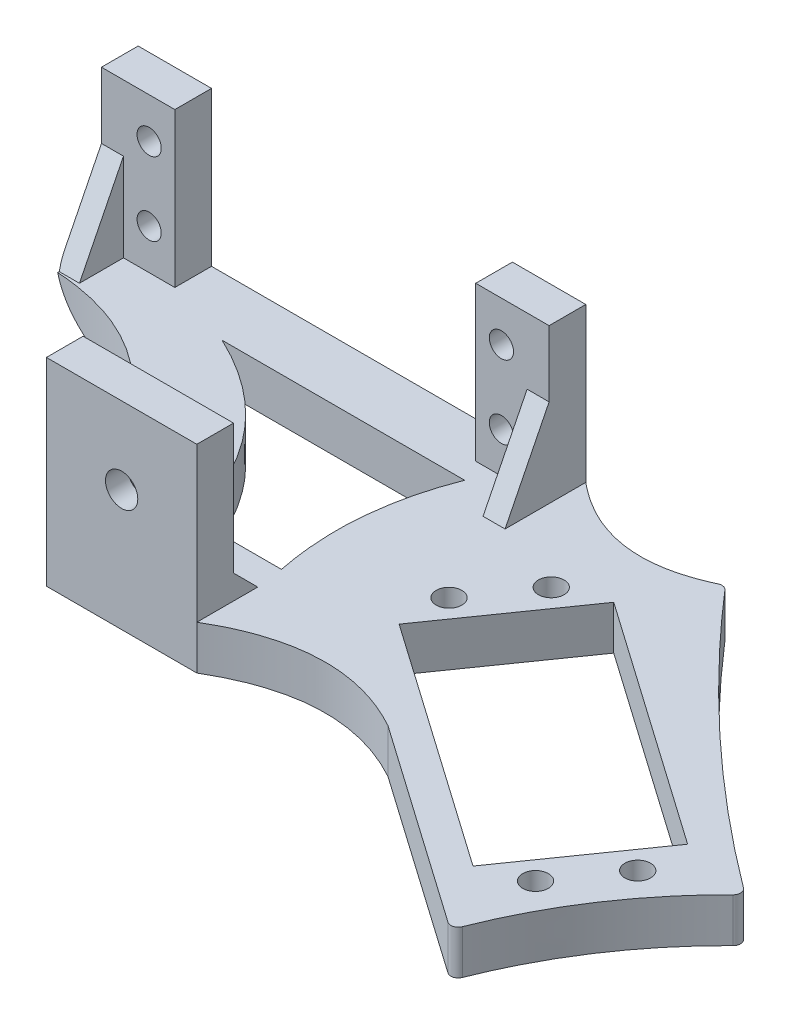
from build123d import *

# Parameters (mm, degrees)
SKETCH1_W               = 130
SKETCH1_H               = 70
BOSS_EXTRUDE1_DEPTH     = 27
SKETCH2_R               = 1.75
CUT_EXTRUDE1_DEPTH      = 27
CUT_EXTRUDE2_START      = -21
CUT_EXTRUDE2_OUTLINE_R  = 1.75
CUT_EXTRUDE2_DEPTH      = 21
CUT_EXTRUDE3_DEPTH      = 100.823879977
CUT_EXTRUDE3_DEPTH_BACK = 100.823879977
CUT_EXTRUDE4_DEPTH      = 80.987499152
CUT_EXTRUDE4_DEPTH_BACK = 80.987499152
SKETCH5_R               = 1.65
SKETCH5_R_2             = 2.2
CUT_EXTRUDE5_DEPTH      = 2
FILLET2_R               = 8


# Read off the part's stored shape, not the designer's step: Cut-Extrude2
with BuildPart() as part:
    # Sketch1 → Boss-Extrude1 (new body)
    with BuildSketch(Plane(origin=(0, 0, 0), x_dir=(1, 0, 0), z_dir=(0, 1, 0))):
        Rectangle(SKETCH1_W, SKETCH1_H)
    extrude(amount=BOSS_EXTRUDE1_DEPTH)

    # Sketch2 → Cut-Extrude1 (cut)
    with BuildSketch(Plane(origin=(0, 27, 0), x_dir=(1, 0, 0), z_dir=(0, 1, 0))):
        with BuildLine():
            Line((65, 35), (-4, 35))
            add(Edge.make_bspline(
                [(16.985276193, 32.037400285), (16.344384253, 31.734586923), (15.139997676, 31.224413868), (13.363177927, 30.647367552), (11.717672063, 30.264833972), (10.188111987, 30.048519757), (8.761038737, 29.968698707), (7.386612758, 30.001896041), (6.043994999, 30.146954639), (4.647593927, 30.414660082), (3.19578664, 30.821123925), (1.740907748, 31.375111265), (0.506749671, 31.963769434), (-0.587741435, 32.566280044), (-1.628944852, 33.212844151), (-2.805878859, 34.038462463), (-3.58582038, 34.654179882), (-4, 35)],
                knots=[0, 0, 0, 0, 0.094281903, 0.173839808, 0.248204838, 0.318741989, 0.379062302, 0.438143998, 0.501439531, 0.558475445, 0.627109695, 0.701723198, 0.765277059, 0.808848652, 0.867872888, 0.928222089, 1, 1, 1, 1], degree=3))
            ThreePointArc((16.985276193, 32.037400285), (17.619352011, 32.111625453), (18.169122212, 31.787103892))
            add(Edge.make_bspline(
                [(18.169122212, 31.787103892), (18.880572219, 30.963826417), (20.353964659, 29.282877442), (22.960721292, 26.394523325), (25.956424204, 23.194668161), (29.413337423, 19.655492092), (32.721030959, 16.412362495), (36.121712054, 13.209386341), (40.056563488, 9.645356576), (46.199565364, 4.366442592), (51.289830213, 0.354927225), (54.600855171, -2.113733504)],
                knots=[0, 0, 0, 0, 0.065465906, 0.134483043, 0.234080041, 0.329168047, 0.432121818, 0.51276386, 0.610223282, 0.751517468, 1, 1, 1, 1], degree=3))
            ThreePointArc((54.600855171, -2.113733504), (55.000762083, -2.84691143), (54.704832326, -3.627873009))
            add(Edge.make_bspline(
                [(54.704832326, -3.627873009), (53.498966947, -4.81552915), (51.311897548, -7.140167952), (48.69963123, -10.367424816), (46.601925875, -13.292582874), (44.80812232, -16.078484523), (43.184554029, -18.939393608), (41.54418466, -22.201248931), (40.571491097, -24.44033411), (40.018197727, -25.840134095)],
                knots=[0, 0, 0, 0, 0.189281305, 0.356736472, 0.463941083, 0.591760781, 0.727143489, 0.83164987, 1, 1, 1, 1], degree=3))
            ThreePointArc((40.018197727, -25.840134095), (39.375842934, -26.43026519), (38.514642112, -26.291673943))
            Line((38.514642112, -26.291673943), (11.207024421, -7.170674209))
            add(Edge.make_bspline(
                [(-14, -8), (-12.271757293, -6.971672517), (-9.466063488, -5.598856445), (-5.386625364, -4.405667761), (-2.228024111, -3.944265665), (0.835893041, -3.933946272), (3.534272193, -4.284331997), (7.080143183, -5.174272804), (9.554008371, -6.255827229), (11.207024421, -7.170674209)],
                knots=[0, 0, 0, 0, 0.227553532, 0.351236087, 0.479384283, 0.587200541, 0.696804288, 0.786205014, 1, 1, 1, 1], degree=3))
            Line((-14, -8), (-34.5, -8))
            add(Edge.make_bspline(
                [(-34.5, -8), (-34.998716381, -6.018305789), (-35.964034069, -2.659544028), (-37.427398174, 1.315845087), (-38.863544091, 4.641999873), (-40.252890439, 7.393277622), (-42.354272337, 10.856052977), (-44.782138282, 14.09338159), (-47.910103128, 17.205621078), (-51.557866637, 19.931151613), (-55.480439434, 21.894814973), (-60.176202103, 23.297139891), (-63.196027982, 23.703049389), (-65, 23.797699279)],
                knots=[0, 0, 0, 0, 0.128897983, 0.220226627, 0.266962342, 0.357379422, 0.414326697, 0.522335212, 0.611659128, 0.691709781, 0.808709753, 0.886032473, 1, 1, 1, 1], degree=3))
            Line((-65, 23.797699279), (-65, -35))
            Line((-65, -35), (65, -35))
            Line((65, -35), (65, 35))
        make_face()
        Polygon((33.591106657, -17.961078948), (0.005872841, 5.555554943), (12.050978004, 22.757747873), (45.63621182, -0.758886018), align=None)
        with BuildLine():
            add(Edge.make_bspline(
                [(-12.50850871, 27), (-13.456798873, 24.573487755), (-14.814722597, 19.89522318), (-15.579858129, 12.089800552), (-15.057965095, 6.888745359), (-14.472989206, 4)],
                knots=[0, 0, 0, 0, 0.333751147, 0.622103639, 1, 1, 1, 1], degree=3))
            Line((-14.472989206, 4), (-26.5, 4))
            add(Edge.make_bspline(
                [(-45.563538233, 27), (-42.772339428, 25.689399679), (-38.343403879, 22.999001318), (-33.000298141, 17.764831394), (-28.975299715, 11.692876511), (-27.193040414, 6.790024988), (-26.5, 4)],
                knots=[0, 0, 0, 0, 0.299156058, 0.498403991, 0.72092627, 1, 1, 1, 1], degree=3))
            Line((-45.563538233, 27), (-12.50850871, 27))
        make_face()
        with Locations(Location((0.293511086, 12.068408714, 0), (0, 0, 270))):
            Circle(SKETCH2_R)
        with Locations(Location((6.029275449, 20.259929156, 0), (0, 0, 270))):
            Circle(SKETCH2_R)
        with Locations(Location((45.348573575, -7.271739788, 0), (0, 0, 270))):
            Circle(SKETCH2_R)
        with Locations(Location((39.612809212, -15.463260231, 0), (0, 0, 270))):
            Circle(SKETCH2_R)
    extrude(amount=-CUT_EXTRUDE1_DEPTH, mode=Mode.SUBTRACT)

    # Cut-Extrude2 outline → Cut-Extrude2 (cut)
    with BuildSketch(Plane(origin=(0, 27, 0), x_dir=(1, 0, 0), z_dir=(0, 1, 0)).offset(CUT_EXTRUDE2_START)):
        with BuildLine():
            add(Edge.make_bspline(
                [(-34.5, -8), (-34.998716381, -6.018305789), (-35.964034069, -2.659544028), (-37.427398174, 1.315845087), (-38.863544091, 4.641999873), (-40.252890439, 7.393277622), (-42.354272337, 10.856052977), (-44.782138282, 14.09338159), (-47.910103128, 17.205621078), (-51.557866637, 19.931151613), (-55.480439434, 21.894814973), (-60.176202103, 23.297139891), (-63.196027982, 23.703049389), (-65, 23.797699279)],
                knots=[0, 0, 0, 0, 0.128897983, 0.220226627, 0.266962342, 0.357379422, 0.414326697, 0.522335212, 0.611659128, 0.691709781, 0.808709753, 0.886032473, 1, 1, 1, 1], degree=3))
            Line((-34.5, -8), (-34.5, 0.3))
            Line((-34.5, 0.3), (-14, 0.3))
            Line((-14, 0.3), (-14, -8))
            add(Edge.make_bspline(
                [(-14, -8), (-12.271757293, -6.971672517), (-9.466063488, -5.598856445), (-5.386625364, -4.405667761), (-2.228024111, -3.944265665), (0.835893041, -3.933946272), (3.534272193, -4.284331997), (7.080143183, -5.174272804), (9.554008371, -6.255827229), (11.207024421, -7.170674209)],
                knots=[0, 0, 0, 0, 0.227553532, 0.351236087, 0.479384283, 0.587200541, 0.696804288, 0.786205014, 1, 1, 1, 1], degree=3))
            Line((11.207024421, -7.170674209), (38.514642112, -26.291673943))
            ThreePointArc((38.514642112, -26.291673943), (39.375842934, -26.43026519), (40.018197727, -25.840134095))
            add(Edge.make_bspline(
                [(54.704832326, -3.627873009), (53.498966947, -4.81552915), (51.311897548, -7.140167952), (48.69963123, -10.367424816), (46.601925875, -13.292582874), (44.80812232, -16.078484523), (43.184554029, -18.939393608), (41.54418466, -22.201248931), (40.571491097, -24.44033411), (40.018197727, -25.840134095)],
                knots=[0, 0, 0, 0, 0.189281305, 0.356736472, 0.463941083, 0.591760781, 0.727143489, 0.83164987, 1, 1, 1, 1], degree=3))
            ThreePointArc((54.704832326, -3.627873009), (55.000762083, -2.84691143), (54.600855171, -2.113733504))
            add(Edge.make_bspline(
                [(18.169122212, 31.787103892), (18.880572219, 30.963826417), (20.353964659, 29.282877442), (22.960721292, 26.394523325), (25.956424204, 23.194668161), (29.413337423, 19.655492092), (32.721030959, 16.412362495), (36.121712054, 13.209386341), (40.056563488, 9.645356576), (46.199565364, 4.366442592), (51.289830213, 0.354927225), (54.600855171, -2.113733504)],
                knots=[0, 0, 0, 0, 0.065465906, 0.134483043, 0.234080041, 0.329168047, 0.432121818, 0.51276386, 0.610223282, 0.751517468, 1, 1, 1, 1], degree=3))
            ThreePointArc((18.169122212, 31.787103892), (17.619352011, 32.111625453), (16.985276193, 32.037400285))
            add(Edge.make_bspline(
                [(16.985276193, 32.037400285), (16.344384253, 31.734586923), (15.139997676, 31.224413868), (13.363177927, 30.647367552), (11.717672063, 30.264833972), (10.188111987, 30.048519757), (8.761038737, 29.968698707), (7.386612758, 30.001896041), (6.043994999, 30.146954639), (4.647593927, 30.414660082), (3.19578664, 30.821123925), (1.740907748, 31.375111265), (0.506749671, 31.963769434), (-0.587741435, 32.566280044), (-1.628944852, 33.212844151), (-2.805878859, 34.038462463), (-3.58582038, 34.654179882), (-4, 35)],
                knots=[0, 0, 0, 0, 0.094281903, 0.173839808, 0.248204838, 0.318741989, 0.379062302, 0.438143998, 0.501439531, 0.558475445, 0.627109695, 0.701723198, 0.765277059, 0.808848652, 0.867872888, 0.928222089, 1, 1, 1, 1], degree=3))
            Line((-4, 35), (-4, 24))
            Line((-4, 24), (-7, 24))
            Line((-7, 24), (-7, 30))
            Line((-7, 30), (-14, 30))
            Line((-14, 30), (-14, 35))
            Line((-14, 35), (-55, 35))
            Line((-55, 35), (-55, 30))
            Line((-55, 30), (-62, 30))
            Line((-62, 30), (-62, 24))
            Line((-62, 24), (-65, 24))
            Line((-65, 24), (-65, 23.797699279))
        make_face()
        with Locations((39.612809212, -15.463260231)):
            Circle(CUT_EXTRUDE2_OUTLINE_R, mode=Mode.SUBTRACT)
        Polygon((45.63621182, -0.758886018), (33.591106657, -17.961078948), (0.005872841, 5.555554943), (12.050978004, 22.757747873), align=None, mode=Mode.SUBTRACT)
        with Locations((45.348573575, -7.271739788)):
            Circle(CUT_EXTRUDE2_OUTLINE_R, mode=Mode.SUBTRACT)
        with BuildLine():
            Line((-45.563538233, 27), (-12.50850871, 27))
            add(Edge.make_bspline(
                [(-12.50850871, 27), (-13.456798873, 24.573487755), (-14.814722597, 19.89522318), (-15.579858129, 12.089800552), (-15.057965095, 6.888745359), (-14.472989206, 4)],
                knots=[0, 0, 0, 0, 0.333751147, 0.622103639, 1, 1, 1, 1], degree=3))
            Line((-14.472989206, 4), (-26.5, 4))
            add(Edge.make_bspline(
                [(-45.563538233, 27), (-42.772339428, 25.689399679), (-38.343403879, 22.999001318), (-33.000298141, 17.764831394), (-28.975299715, 11.692876511), (-27.193040414, 6.790024988), (-26.5, 4)],
                knots=[0, 0, 0, 0, 0.299156058, 0.498403991, 0.72092627, 1, 1, 1, 1], degree=3))
        make_face(mode=Mode.SUBTRACT)
        with Locations((0.293511086, 12.068408714)):
            Circle(CUT_EXTRUDE2_OUTLINE_R, mode=Mode.SUBTRACT)
        with Locations((6.029275449, 20.259929156)):
            Circle(CUT_EXTRUDE2_OUTLINE_R, mode=Mode.SUBTRACT)
    extrude(amount=CUT_EXTRUDE2_DEPTH, mode=Mode.SUBTRACT)

    # Sketch4 → Cut-Extrude3 (cut, two sides: drawn at the far end of the back side and taken through both)
    with BuildSketch(Plane.ZY.offset(34.5).offset(-CUT_EXTRUDE3_DEPTH_BACK)):
        Polygon((-0.3, 27), (3, 27), (3, 9.3), (-0.3, 6), align=None)
        Polygon((-24, 27), (-30, 27), (-30, 18), (-24, 6), align=None)
    extrude(amount=CUT_EXTRUDE3_DEPTH + CUT_EXTRUDE3_DEPTH_BACK, mode=Mode.SUBTRACT)

    # Sketch5 → Cut-Extrude4 (cut, two sides: drawn at the far end of the back side and taken through both)
    with BuildSketch(Plane(origin=(0, 0, 3), x_dir=(-1, 0, 0), z_dir=(0, 0, -1)).offset(-CUT_EXTRUDE4_DEPTH_BACK)):
        with Locations((10.5, 21.5)):
            Circle(SKETCH5_R)
        with Locations((10.5, 11.5)):
            Circle(SKETCH5_R)
        with Locations((58.5, 21.5)):
            Circle(SKETCH5_R)
        with Locations((58.5, 11.5)):
            Circle(SKETCH5_R)
        with Locations(Location((24.25, 16.5, 0), (0, 0, 180))):
            Circle(SKETCH5_R_2)
    extrude(amount=CUT_EXTRUDE4_DEPTH + CUT_EXTRUDE4_DEPTH_BACK, mode=Mode.SUBTRACT)

    # Sketch6 → Cut-Extrude5 (cut)
    with BuildSketch(Plane(origin=(0, 0, 3), x_dir=(-1, 0, 0), z_dir=(0, 0, -1))):
        Polygon((26.386195996, 20.2), (22.113804004, 20.2), (19.977608008, 16.5), (22.113804004, 12.8), (26.386195996, 12.8), (28.522391992, 16.5), align=None)
    extrude(amount=-CUT_EXTRUDE5_DEPTH, mode=Mode.SUBTRACT)

    # Fillet2
    fillet2_edges = [part.edges().sort_by_distance(p)[0] for p in [
        (-65, 0, -29.398849639),
    ]]
    fillet(fillet2_edges, radius=FILLET2_R)


solid = part.part
